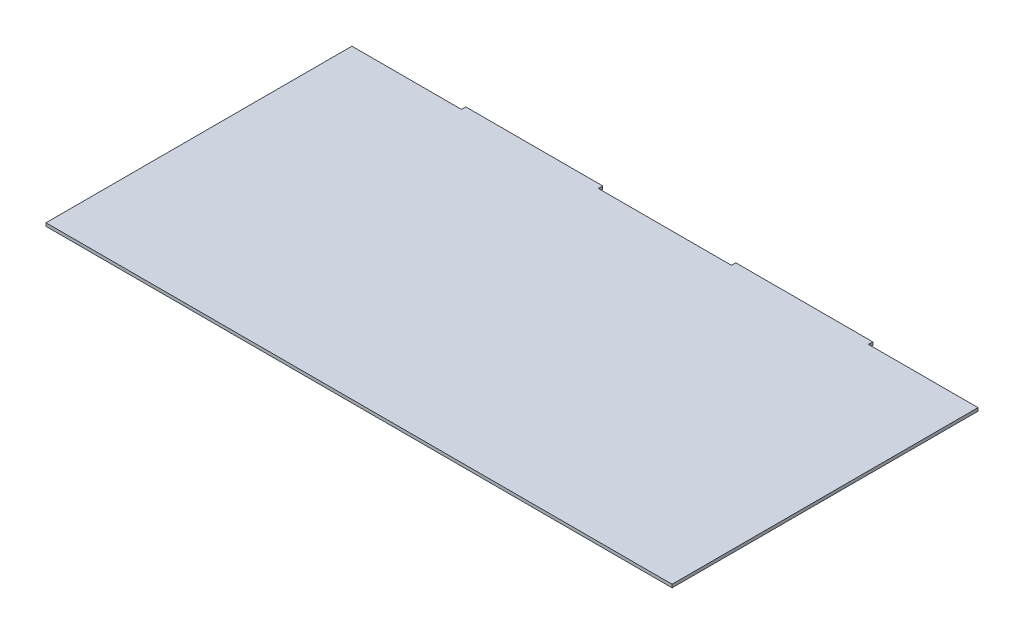
from build123d import *

# Parameters (mm, degrees)
SKETCH1_W           = 457.2
SKETCH1_H           = 2.286
BOSS_EXTRUDE1_DEPTH = 223.380000026
SKETCH2_W           = 100
SKETCH2_H           = 2.286
BOSS_EXTRUDE2_DEPTH = 3.175


with BuildPart() as part:
    # Sketch1 → Boss-Extrude1 (new body)
    with BuildSketch(Plane.XY):
        Rectangle(SKETCH1_W, SKETCH1_H)
    extrude(amount=BOSS_EXTRUDE1_DEPTH)

    # Sketch2 → Boss-Extrude2 (add)
    with BuildSketch(Plane(origin=(0, 0, 0), x_dir=(-1, 0, 0), z_dir=(0, 0, -1))):
        with Locations((-98.6115, 0)):
            Rectangle(SKETCH2_W, SKETCH2_H)
        with Locations((98.6115, 0)):
            Rectangle(SKETCH2_W, SKETCH2_H)
    extrude(amount=BOSS_EXTRUDE2_DEPTH)


solid = part.part
